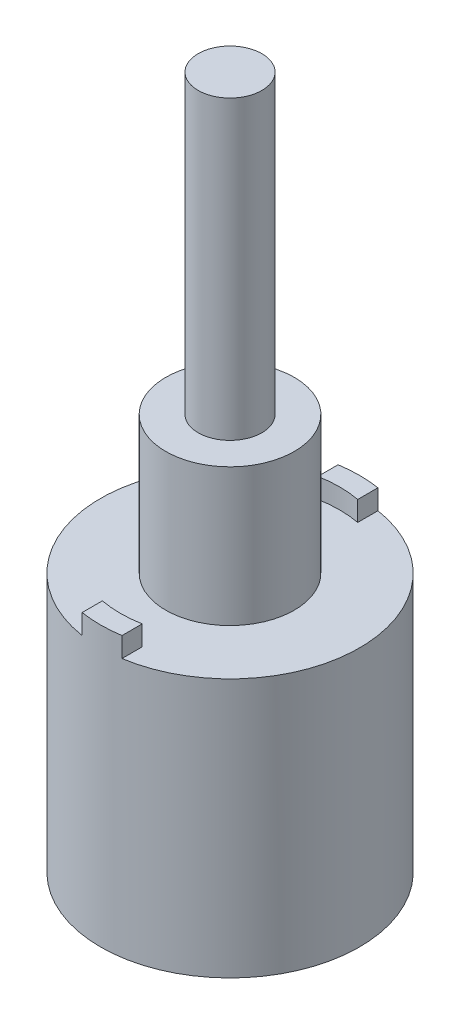
from build123d import *

# Parameters (mm, degrees)
SKETCH1_R           = 6.5
BOSS_EXTRUDE1_DEPTH = 13
SKETCH2_R           = 3.225
BOSS_EXTRUDE2_DEPTH = 6.9
SKETCH3_R           = 1.6
BOSS_EXTRUDE3_DEPTH = 14.88
BOSS_EXTRUDE4_DEPTH = 1


with BuildPart() as part:
    # Sketch1 → Boss-Extrude1 (new body)
    with BuildSketch(Plane(origin=(0, 0, 0), x_dir=(1, 0, 0), z_dir=(0, 1, 0))):
        Circle(SKETCH1_R)
    extrude(amount=BOSS_EXTRUDE1_DEPTH)

    # Sketch2 → Boss-Extrude2 (add)
    with BuildSketch(Plane(origin=(0, 13, 0), x_dir=(1, 0, 0), z_dir=(0, 1, 0))):
        Circle(SKETCH2_R)
    extrude(amount=BOSS_EXTRUDE2_DEPTH)

    # Sketch3 → Boss-Extrude3 (add)
    with BuildSketch(Plane(origin=(0, 19.9, 0), x_dir=(1, 0, 0), z_dir=(0, 1, 0))):
        Circle(SKETCH3_R)
    extrude(amount=BOSS_EXTRUDE3_DEPTH)

    # Sketch4 → Boss-Extrude4 (add)
    with BuildSketch(Plane(origin=(0, 13, 0), x_dir=(1, 0, 0), z_dir=(0, 1, 0))):
        with BuildLine():
            ThreePointArc((-1, 5.408326913), (0, 5.5), (1, 5.408326913))
            Line((1, 5.408326913), (1, 6.422616289))
            ThreePointArc((1, 6.422616289), (0, 6.5), (-1, 6.422616289))
            Line((-1, 6.422616289), (-1, 5.408326913))
        make_face()
        with BuildLine():
            ThreePointArc((1, -5.408326913), (0, -5.5), (-1, -5.408326913))
            Line((-1, -5.408326913), (-1, -6.422616289))
            ThreePointArc((-1, -6.422616289), (0, -6.5), (1, -6.422616289))
            Line((1, -6.422616289), (1, -5.408326913))
        make_face()
    extrude(amount=BOSS_EXTRUDE4_DEPTH)


solid = part.part
